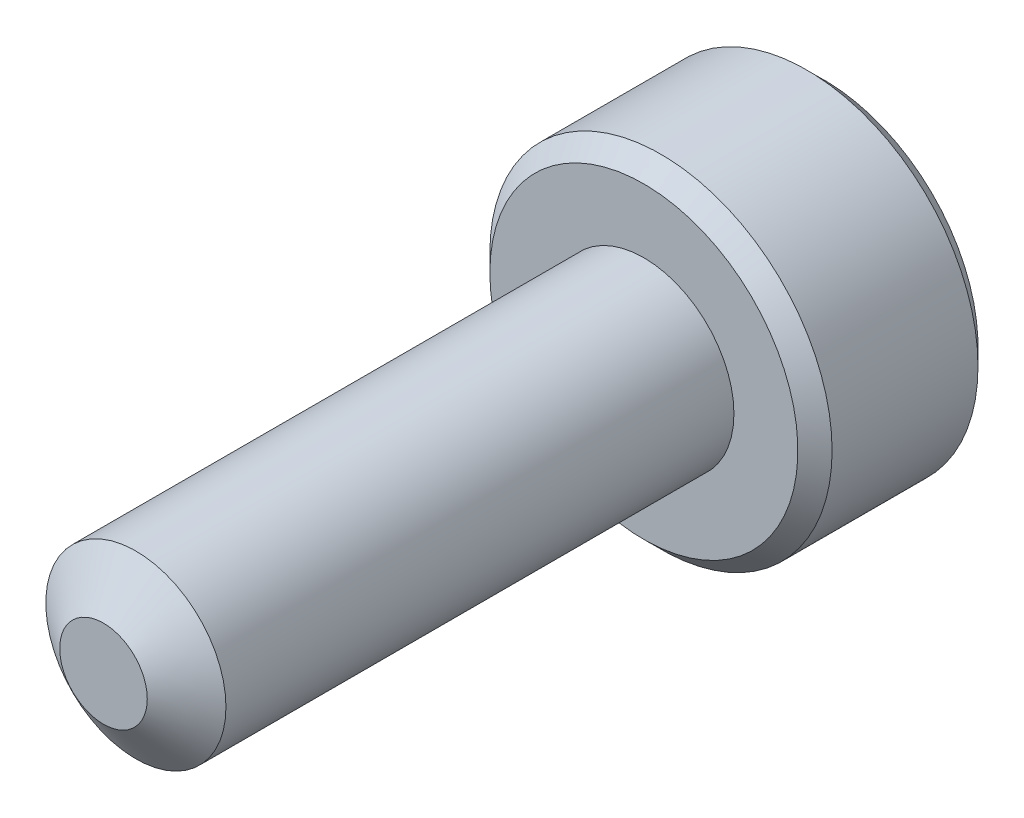
from build123d import *

# Parameters (mm, degrees)
SKETCH1_R          = 1
EXTRUDE1_DEPTH     = 6
SKETCH6_R          = 1.9
EXTRUDE2_DEPTH     = 2
CUT_EXTRUDE1_DEPTH = 1.125
CHAMFER1_SIZE      = 0.19


with BuildPart() as part:
    # Sketch1 → Extrude1 (new body)
    with BuildSketch(Plane.XY):
        Circle(SKETCH1_R)
    extrude(amount=-EXTRUDE1_DEPTH)

    # Sketch4 → Cut-Revolve1 (revolve, cut)
    with BuildSketch(Plane(origin=(0, 0, 0), x_dir=(0, 0, -1), z_dir=(1, 0, 0))):
        Polygon((0.35977197, 1), (0, 0.486192379), (0, 1), align=None)
    revolve(axis=Axis((0, 0, 0), (0, 0, -1)), mode=Mode.SUBTRACT)

    # Sketch6 → Extrude2 (add)
    with BuildSketch(Plane(origin=(0, 0, -6), x_dir=(-1, 0, 0), z_dir=(0, 0, -1))):
        Circle(SKETCH6_R)
    extrude(amount=EXTRUDE2_DEPTH)

    # Sketch7 → Cut-Extrude1 (cut)
    with BuildSketch(Plane(origin=(0, 0, -8), x_dir=(-1, 0, 0), z_dir=(0, 0, -1))):
        Polygon((0, 0.866025404), (-0.75, 0.433012702), (-0.75, -0.433012702), (0, -0.866025404), (0.75, -0.433012702), (0.75, 0.433012702), align=None)
    extrude(amount=-CUT_EXTRUDE1_DEPTH, mode=Mode.SUBTRACT)

    # Cut-Extrude2 cone 1 section (through the dimple's axis) → Cut-Extrude2 (revolve, cut)
    with BuildSketch(Plane(origin=(0, 0, -8), x_dir=(0, 1, 0), z_dir=(1, 0, 0))):
        Polygon((0, 0), (0.866025404, 0), (0, 0.866025404), align=None)
    revolve(axis=Axis((0, 0, -8), (0, 0, 1)), mode=Mode.SUBTRACT)

    # Chamfer1
    chamfer1_edges = [part.edges().sort_by_distance(p)[0] for p in [
        (1.9, 0, -8),
        (1.9, 0, -6),
    ]]
    chamfer(chamfer1_edges, length=CHAMFER1_SIZE)


solid = part.part
